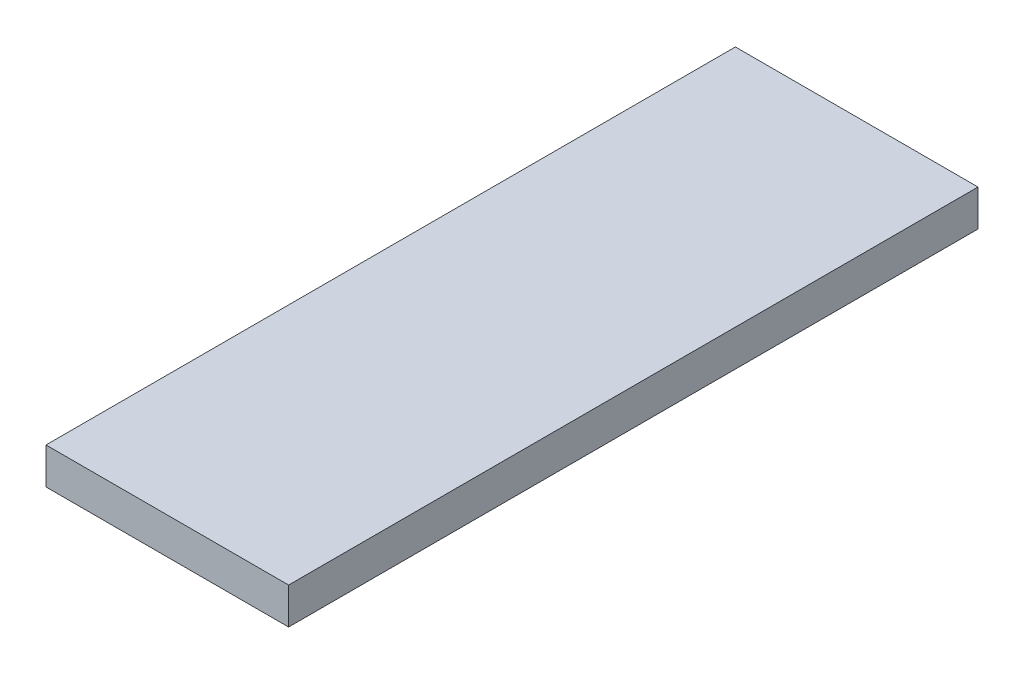
from build123d import *

# Parameters (mm, degrees)
SKETCH_1_W      = 20
SKETCH_1_H      = 56.83
EXTRUDE_1_DEPTH = 3


with BuildPart() as part:
    # Sketch 1 → Бобышка-Вытянуть1 (new body)
    with BuildSketch(Plane(origin=(0, 0, 0), x_dir=(1, 0, 0), z_dir=(0, 1, 0))):
        Rectangle(SKETCH_1_W, SKETCH_1_H)
    extrude(amount=EXTRUDE_1_DEPTH)


solid = part.part
